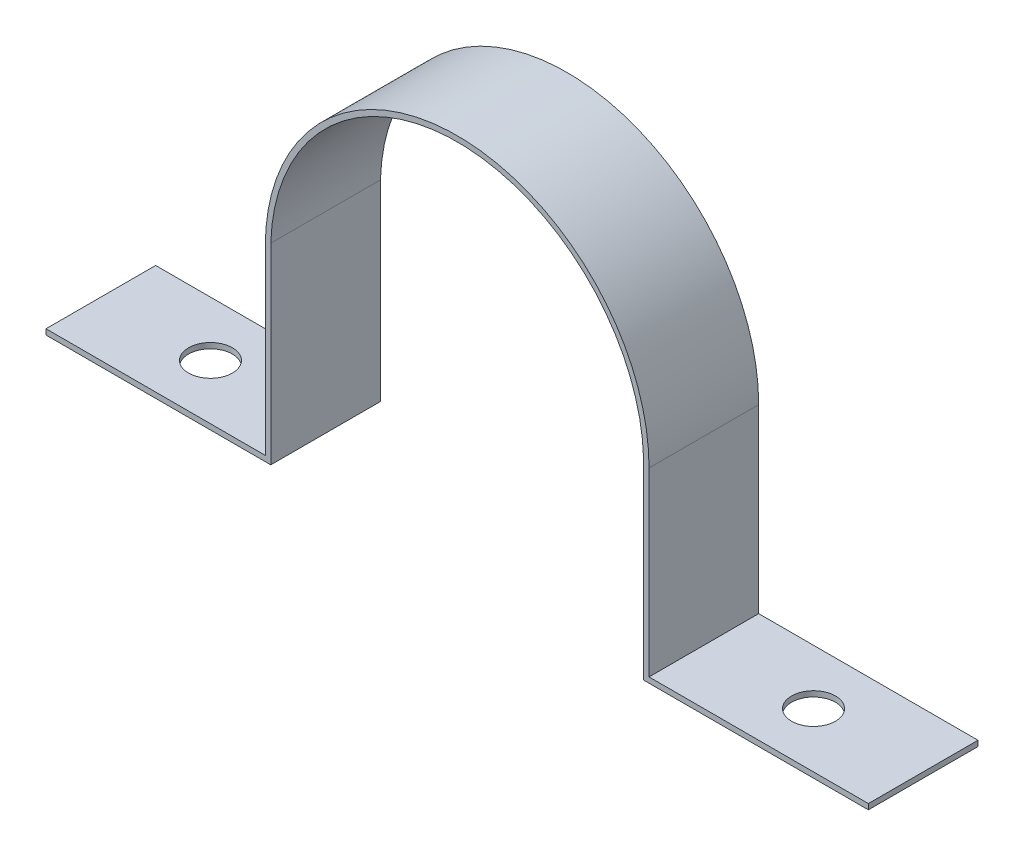
from build123d import *

# Parameters (mm, degrees)
SALIENTE_EXTRUIR1_DEPTH = 10
CROQUIS2_R              = 2
CORTAR_EXTRUIR1_DEPTH   = 10


with BuildPart() as part:
    # Croquis1 → Saliente-Extruir1 (new body)
    with BuildSketch(Plane.XY):
        with BuildLine():
            Line((-17.5, 0), (-17.5, -16.507351352))
            Line((-17.5, -16.507351352), (-37.5, -16.507351352))
            Line((-37.5, -16.507351352), (-37.5, -17.007351352))
            Line((-37.5, -17.007351352), (-17, -17.007351352))
            Line((-17, -17.007351352), (-17, 0.5))
            ThreePointArc((-17, 0.5), (0, 17.007351352), (17, 0.5))
            Line((17, 0.5), (17, -17.007351352))
            Line((17, -17.007351352), (37.5, -17.007351352))
            Line((37.5, -17.007351352), (37.5, -16.507351352))
            Line((37.5, -16.507351352), (17.5, -16.507351352))
            Line((17.5, -16.507351352), (17.5, 0))
            ThreePointArc((17.5, 0), (0, 17.5), (-17.5, 0))
        make_face()
    extrude(amount=SALIENTE_EXTRUIR1_DEPTH)

    # Croquis2 → Cortar-Extruir1 (cut)
    with BuildSketch(Plane(origin=(0, -16.507351352, 0), x_dir=(1, 0, 0), z_dir=(0, 1, 0))):
        with Locations((-27.5, -5)):
            Circle(CROQUIS2_R)
        with Locations((27.5, -5)):
            Circle(CROQUIS2_R)
    extrude(amount=-CORTAR_EXTRUIR1_DEPTH, mode=Mode.SUBTRACT)


solid = part.part
